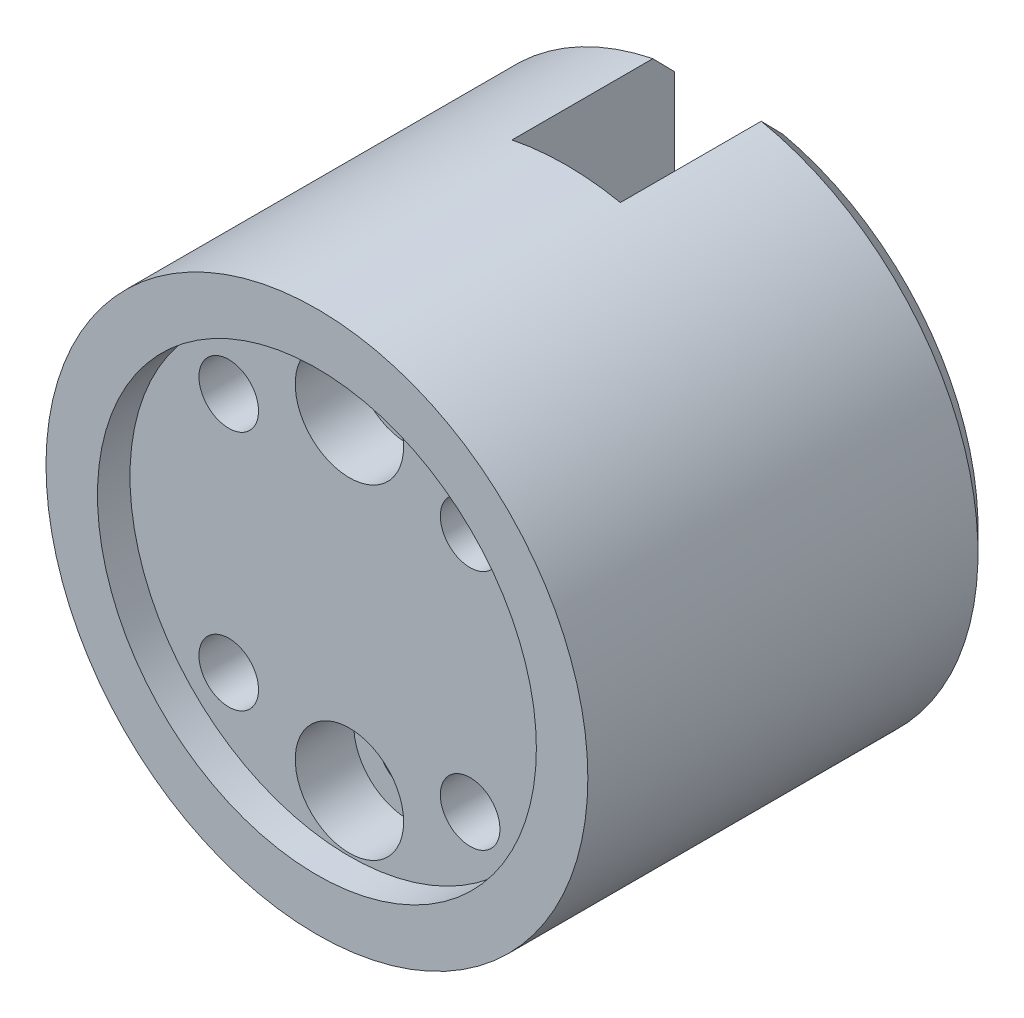
from build123d import *
from build123d.topology import SkipClean

# Parameters (mm, degrees)
SKETCH1_R                                           = 25
BOSS_EXTRUDE1_DEPTH                                 = 15
CUT_EXTRUDE1_DEPTH                                  = 4
SKETCH3_R                                           = 2
CUT_EXTRUDE2_DEPTH                                  = 39.405728739
CUT_EXTRUDE3_DEPTH                                  = 4
FILLET1_R                                           = 0.5
SKETCH5_R                                           = 0.5
CUT_EXTRUDE4_DEPTH                                  = 8
F_5_5_5_5_DIAMETER_HOLE1_D                          = 5.5
CUT_EXTRUDE5_DEPTH                                  = 37.249138081
SKETCH9_R                                           = 25
SKETCH9_R_2                                         = 20.25
BOSS_EXTRUDE2_DEPTH                                 = 3
BOSS_EXTRUDE3_START                                 = 7
BOSS_EXTRUDE3_DEPTH                                 = 7
FILLET3_R                                           = 1
FILLET4_R                                           = 1
BOSS_EXTRUDE4_START                                 = -8
SKETCH11_R                                          = 25
SKETCH11_R_2                                        = 2.75
BOSS_EXTRUDE4_DEPTH                                 = 8
CBORE_FOR_M5_HEX_SOCKET_HEAD_CAP_SCR_2_COUNT        = 2
CBORE_FOR_M5_HEX_SOCKET_HEAD_CAP_SCR_2_PITCH        = 22.273863607
CBORE_FOR_M5_HEX_SOCKET_HEAD_CAP_SCR_3_COUNT        = 2
CBORE_FOR_M5_HEX_SOCKET_HEAD_CAP_SCR_3_PITCH        = 22.273863607
CBORE_FOR_M5_HEX_SOCKET_HEAD_CAP_SCR_4_COUNT        = 2
CBORE_FOR_M5_HEX_SOCKET_HEAD_CAP_SCR_4_PITCH        = 31.5
BOSS_EXTRUDE5_START                                 = 20
SKETCH15_R                                          = 25
SKETCH15_R_2                                        = 5
SKETCH15_R_3                                        = 5.025
BOSS_EXTRUDE5_DEPTH                                 = 20
CUT_EXTRUDE7_DEPTH                                  = 41.620192146
CUT_EXTRUDE7_DEPTH_BACK                             = 41.620192146
SKETCH16_W                                          = 10
SKETCH16_H                                          = 16.387019029
CBORE_FOR_M5_HEX_SOCKET_HEAD_CAP_SCREW2_D           = 5.5
CBORE_FOR_M5_HEX_SOCKET_HEAD_CAP_SCREW2_CBORE_D     = 10
CBORE_FOR_M5_HEX_SOCKET_HEAD_CAP_SCREW2_CBORE_DEPTH = 5.4
CHAMFER1_SIZE                                       = 2


with BuildPart() as part:
    # Sketch1 → Boss-Extrude1 (new body)
    with BuildSketch(Plane.XY):
        Circle(SKETCH1_R)
    extrude(amount=BOSS_EXTRUDE1_DEPTH)

    # Sketch2 → Cut-Extrude1 (cut)
    with BuildSketch(Plane(origin=(0, 0, 0), x_dir=(-1, 0, 0), z_dir=(0, 0, -1))):
        Polygon((0, 4), (2.3, 4), (2.3, 4.75), (13.4, 4.75), (13.4, 3), (16.4, 3), (16.4, 25), (28.321861399, 25), (28.321861399, -25), (16.4, -25), (16.4, -3), (13.4, -3), (13.4, -4.75), (2.3, -4.75), (2.3, -4), (0, -4), (0, -2), (-29.291687819, -2), (-29.291687819, 2), (0, 2), align=None)
    extrude(amount=-CUT_EXTRUDE1_DEPTH, mode=Mode.SUBTRACT)

    # Sketch3 → Cut-Extrude2 (cut, through all)
    with BuildSketch(Plane.ZY):
        with Locations((4, 0)):
            Circle(SKETCH3_R)
    extrude(amount=-CUT_EXTRUDE2_DEPTH, mode=Mode.SUBTRACT)

    # Sketch4 → Cut-Extrude3 (cut)
    with BuildSketch(Plane(origin=(0, 0, 4), x_dir=(-1, 0, 0), z_dir=(0, 0, -1))):
        with BuildLine():
            Line((0, -2), (0, -4))
            Line((0, -4), (2.3, -4))
            Line((2.3, -4), (2.3, -4.75))
            Line((2.3, -4.75), (13.4, -4.75))
            Line((13.4, -4.75), (13.4, -3))
            Line((13.4, -3), (16.4, -3))
            Line((16.4, -3), (16.4, -18.869022232))
            ThreePointArc((16.4, -18.869022232), (25, 0), (16.4, 18.869022232))
            Line((16.4, 18.869022232), (16.4, 3))
            Line((16.4, 3), (13.4, 3))
            Line((13.4, 3), (13.4, 4.75))
            Line((13.4, 4.75), (2.3, 4.75))
            Line((2.3, 4.75), (2.3, 4))
            Line((2.3, 4), (0, 4))
            Line((0, 4), (0, 2))
            Line((0, 2), (0, -2))
        make_face()
    extrude(amount=-CUT_EXTRUDE3_DEPTH, mode=Mode.SUBTRACT)

    # Fillet1
    fillet1_edges = [part.edges().sort_by_distance(p)[0] for p in [
        (0, -2, 2),
        (0, 2, 2),
        (0, 0, 6),
    ]]
    fillet(fillet1_edges, radius=FILLET1_R)

    # Sketch5 → Cut-Extrude4 (cut)
    with BuildSketch(Plane(origin=(0, 0, 0), x_dir=(-1, 0, 0), z_dir=(0, 0, -1))):
        with Locations((0, 4)):
            Circle(SKETCH5_R)
        with Locations((13.4, 4.75)):
            Circle(SKETCH5_R)
        with Locations((0, -4)):
            Circle(SKETCH5_R)
        with Locations((13.4, -4.75)):
            Circle(SKETCH5_R)
    extrude(amount=-CUT_EXTRUDE4_DEPTH, mode=Mode.SUBTRACT)

    # Ø5.5 (5.5) Diameter Hole1 (through all)
    with Locations(Plane(origin=(0, 0, 0), x_dir=(-1, 0, 0), z_dir=(0, 0, -1))):
        with Locations((-11.136931804, 11.136931804), (11.136931804, 11.136931804), (-11.136931804, -11.136931804), (11.136931804, -11.136931804)):
            Hole(F_5_5_5_5_DIAMETER_HOLE1_D / 2)

    # Sketch8 → Cut-Extrude5 (cut, through all)
    with BuildSketch(Plane(origin=(0, 0, 8), x_dir=(-1, 0, 0), z_dir=(0, 0, -1))):
        with BuildLine():
            Line((16.4, 18.869022232), (16.4, -18.869022232))
            ThreePointArc((16.4, -18.869022232), (25, 0), (16.4, 18.869022232))
        make_face()
    extrude(amount=-CUT_EXTRUDE5_DEPTH, mode=Mode.SUBTRACT)

    # Sketch9 → Boss-Extrude2 (add)
    with BuildSketch(Plane.XY.offset(15)):
        with Locations(Location((0, 0, 0), (0, 0, 130.99551881))):
            Circle(SKETCH9_R)
        with Locations(Location((0, 0, 0), (0, 0, 144.083871109))):
            Circle(SKETCH9_R_2, mode=Mode.SUBTRACT)
    extrude(amount=BOSS_EXTRUDE2_DEPTH)

    # Sketch10 → Boss-Extrude3 (add)
    with SkipClean():  # the faces are left unmerged after this step: merging them gives an invalid solid
        with BuildSketch(Plane(origin=(0, 0, 15), x_dir=(-1, 0, 0), z_dir=(0, 0, -1)).offset(BOSS_EXTRUDE3_START)):
            with BuildLine():
                Line((16.4, 18.869022232), (16.4, -18.869022232))
                ThreePointArc((16.4, -18.869022232), (25, 0), (16.4, 18.869022232))
            make_face()
        extrude(amount=-BOSS_EXTRUDE3_DEPTH)

    # Fillet3
    # the kernel refuses this fillet: 1 mm, written as the material it adds along each edge
    with BuildSketch(Plane(origin=(-2.3, 4.75, 10.420614591), x_dir=(0, -1, 0), z_dir=(0, 0, -1)), Plane(origin=(-2.3, -4.75, 0), x_dir=(0, 1, 0), z_dir=(0, 0, 1))) as fillet3_piece_1:
        with BuildLine():
            CenterArc((1, 0.968245837), FILLET3_R, 180, 75.522487814)
            Line((0, 0.968245837), (-0.02, 0.968245837))
            Line((-0.02, 0.968245837), (-0.02, 0))
            Line((-0.02, 0), (0, -0.02))
            ThreePointArc((0, -0.02), (0.375, -0.02), (0.745, -0.019364917))
            Line((0.745, -0.019364917), (0.75, 0))
        make_face()
    extrude(amount=10.420614591)

    # Fillet4
    # the kernel refuses this fillet: 1 mm, written as the material it takes off along each edge
    with BuildSketch(Plane(origin=(-2.3, 4, 8), x_dir=(-0.44744459774228634, 0.894311652586079, 0), z_dir=(0, 0, -1)), Plane(origin=(-2.3, -4, -1.482509158), x_dir=(-0.44744459774200684, -0.8943116525862188, 0), z_dir=(0, 0, 1))) as fillet4_piece_1:
        with BuildLine():
            CenterArc((0.628975367, 0.977774684), FILLET4_R, 206.57984982, 51.317812547)
            Line((-0.265336285, 0.530330086), (0, 0))
            ThreePointArc((0, 0), (0.209658456, 0.022225316), (0.419316911, 0))
        make_face()
    extrude(amount=9.482509158, mode=Mode.SUBTRACT)

    # Sketch11 → Boss-Extrude4 (add)
    with BuildSketch(Plane(origin=(0, 0, 0), x_dir=(-1, 0, 0), z_dir=(0, 0, -1)).offset(BOSS_EXTRUDE4_START)):
        with Locations(Location((0, 0, 0), (0, 0, 180))):
            Circle(SKETCH11_R)
        with Locations((11.136931804, -11.136931804)):
            Circle(SKETCH11_R_2, mode=Mode.SUBTRACT)
        with Locations((11.136931804, 11.136931804)):
            Circle(SKETCH11_R_2, mode=Mode.SUBTRACT)
        with Locations((-11.136931804, -11.136931804)):
            Circle(SKETCH11_R_2, mode=Mode.SUBTRACT)
        with Locations((-11.136931804, 11.136931804)):
            Circle(SKETCH11_R_2, mode=Mode.SUBTRACT)
    extrude(amount=BOSS_EXTRUDE4_DEPTH)

    # Sketch14 → CBORE for M5 Hex Socket Head Cap Screw1 (revolve, cut)
    with BuildSketch(Plane(origin=(11.136931804, -11.136931804, 0), x_dir=(0, 1, 0), z_dir=(1, 0, 0))):
        Polygon((0, 0), (0, 18), (2.75, 18), (2.75, 5.4), (5, 5.4), (5, 0.025), (5.025, 0), align=None)
    cbore_for_m5_hex_socket_head_cap_screw1 = revolve(axis=Axis((11.136931804, -11.136931804, -6.35), (0, 0, 1)), mode=Mode.SUBTRACT)

    # CBORE for M5 Hex Socket Head Cap Scr 2: CBORE for M5 Hex Socket Head Cap Screw1 ×2
    with Locations(*[(0, i * CBORE_FOR_M5_HEX_SOCKET_HEAD_CAP_SCR_2_PITCH, 0) for i in range(1, CBORE_FOR_M5_HEX_SOCKET_HEAD_CAP_SCR_2_COUNT)]):
        add(cbore_for_m5_hex_socket_head_cap_screw1, mode=Mode.SUBTRACT)

    # CBORE for M5 Hex Socket Head Cap Scr 3: CBORE for M5 Hex Socket Head Cap Screw1 ×2
    with Locations(*[(-i * CBORE_FOR_M5_HEX_SOCKET_HEAD_CAP_SCR_3_PITCH, 0, 0) for i in range(1, CBORE_FOR_M5_HEX_SOCKET_HEAD_CAP_SCR_3_COUNT)]):
        add(cbore_for_m5_hex_socket_head_cap_screw1, mode=Mode.SUBTRACT)

    # CBORE for M5 Hex Socket Head Cap Scr 4: CBORE for M5 Hex Socket Head Cap Screw1 ×2
    with Locations(*[Vector(-0.7071067811865435, 0.7071067811865516, 0) * (i * CBORE_FOR_M5_HEX_SOCKET_HEAD_CAP_SCR_4_PITCH) for i in range(1, CBORE_FOR_M5_HEX_SOCKET_HEAD_CAP_SCR_4_COUNT)]):
        add(cbore_for_m5_hex_socket_head_cap_screw1, mode=Mode.SUBTRACT)

    # Sketch15 → Boss-Extrude5 (add)
    with SkipClean():  # the faces are left unmerged after this step: merging them gives an invalid solid
        with BuildSketch(Plane(origin=(0, 0, 0), x_dir=(-1, 0, 0), z_dir=(0, 0, -1)).offset(BOSS_EXTRUDE5_START)):
            Circle(SKETCH15_R)
            with Locations((-11.136931804, -11.136931804)):
                Circle(SKETCH15_R_2, mode=Mode.SUBTRACT)
            with Locations((-11.136931804, 11.136931804)):
                Circle(SKETCH15_R_3, mode=Mode.SUBTRACT)
            with Locations((11.136931804, -11.136931804)):
                Circle(SKETCH15_R_2, mode=Mode.SUBTRACT)
            with Locations((11.136931804, 11.136931804)):
                Circle(SKETCH15_R_2, mode=Mode.SUBTRACT)
        extrude(amount=-BOSS_EXTRUDE5_DEPTH)
    add(part.part.scale(1), mode=Mode.REPLACE)  # the faces are merged on a copy

    # Sketch16 → Cut-Extrude7 (cut, two sides: drawn at the far end of the back side and taken through both)
    with BuildSketch(Plane(origin=(0, 0, 0), x_dir=(1, 0, 0), z_dir=(0, 1, 0)).offset(-CUT_EXTRUDE7_DEPTH_BACK)):
        with Locations((0, 13.193509515)):
            Rectangle(SKETCH16_W, SKETCH16_H)
    extrude(amount=CUT_EXTRUDE7_DEPTH + CUT_EXTRUDE7_DEPTH_BACK, mode=Mode.SUBTRACT)

    # CBORE for M5 Hex Socket Head Cap Screw2 (through all)
    with Locations(Plane.XY.offset(15)):
        with Locations((0, -15), (0, 15)):
            CounterBoreHole(CBORE_FOR_M5_HEX_SOCKET_HEAD_CAP_SCREW2_D / 2, CBORE_FOR_M5_HEX_SOCKET_HEAD_CAP_SCREW2_CBORE_D / 2, CBORE_FOR_M5_HEX_SOCKET_HEAD_CAP_SCREW2_CBORE_DEPTH)

    # Chamfer1
    chamfer1_edges = [part.edges().sort_by_distance(p)[0] for p in [
        (25, 0, -20),
        (-19.364916731, 15.811388301, -20),
    ]]
    chamfer(chamfer1_edges, length=CHAMFER1_SIZE)


solid = part.part
